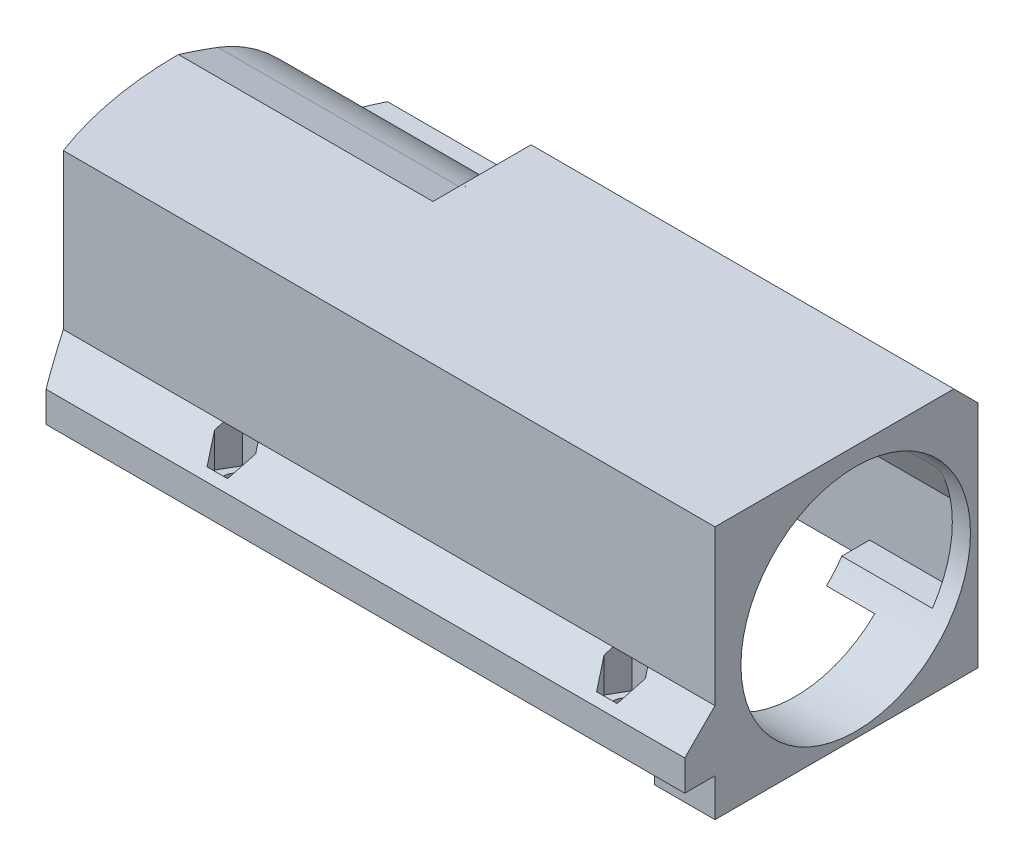
from build123d import *
from build123d.topology import SkipClean

# Parameters (mm, degrees)
BOSS_EXTRUDE1_DEPTH            = 46.6
CUT_EXTRUDE1_REACH             = 137.409
SKETCH2_R                      = 19
SKETCH3_W                      = 3
SKETCH3_H                      = 30.7
BOSS_EXTRUDE2_DEPTH            = 120
SKETCH4_W                      = 5
SKETCH4_H                      = 7.85
BOSS_EXTRUDE3_DEPTH            = 120
SKETCH6_W                      = 3
SKETCH6_H                      = 35.7
BOSS_EXTRUDE4_DEPTH            = 120
SKETCH8_W                      = 4.95
SKETCH8_H                      = 35.7
BOSS_EXTRUDE5_DEPTH            = 120
BOSS_EXTRUDE7_DEPTH            = 117
CHAMFER2_SIZE                  = 8
M3_CLEARANCE_HOLE1_D           = 3.4
M3_CLEARANCE_HOLE1_ON_FACE_2_D = 3.4
SKETCH12_W                     = 8
SKETCH12_H                     = 17.7
CUT_EXTRUDE4_DEPTH             = 140.841195647
CHAMFER4_SIZE                  = 4
CHAMFER5_SIZE                  = 2
CUT_EXTRUDE5_START             = 6.3
CUT_EXTRUDE5_DEPTH             = 35.7
CUT_EXTRUDE6_START             = -70
CUT_EXTRUDE6_DEPTH             = 61.400086431
CUT_EXTRUDE7_START             = -4.5
CUT_EXTRUDE7_DEPTH             = 6.7
M3_CLEARANCE_HOLE2_D           = 3.6
M3_CLEARANCE_HOLE2_DEPTH       = 12.65
CHAMFER6_SIZE                  = 2.2
CUT_EXTRUDE8_DEPTH             = 131.400086431


# Read off the part's stored shape, not the designer's step: Cut-Extrude5
with BuildPart() as part:
    # Sketch1 → Boss-Extrude1 (new body)
    with BuildSketch(Plane.XY):
        Polygon((0, 0), (0, 42), (-120, 42), (-120, 37), (-3, 37), (-3, 9.3), (-18, 9.3), (-18, 6.3), (-10, 6.3), (-10, 0), align=None)
    extrude(amount=BOSS_EXTRUDE1_DEPTH)

    # Sketch2 → Cut-Extrude1 (cut, up to next)
    with BuildSketch(Plane(origin=(0, 0, 0), x_dir=(0, 0, -1), z_dir=(1, 0, 0)), mode=Mode.PRIVATE) as cut_extrude1_sk1:
        with Locations((-23.3, 20)):
            Circle(SKETCH2_R)
    cut_extrude1_tool1 = extrude(cut_extrude1_sk1.sketch, amount=-CUT_EXTRUDE1_REACH, mode=Mode.PRIVATE) & part.part
    add(cut_extrude1_tool1.solids().sort_by_distance((0, 20, 23.3))[0], mode=Mode.SUBTRACT)

    # Sketch3 → Boss-Extrude2 (add)
    with BuildSketch(Plane.ZY.offset(3)):
        with Locations((45.1, 21.65)):
            Rectangle(SKETCH3_W, SKETCH3_H)
    extrude(amount=BOSS_EXTRUDE2_DEPTH)

    # Sketch4 → Boss-Extrude3 (add)
    with BuildSketch(Plane(origin=(0, 0, 0), x_dir=(0, 0, -1), z_dir=(1, 0, 0))):
        with Locations((-49.1, 10.225)):
            Rectangle(SKETCH4_W, SKETCH4_H)
    extrude(amount=-BOSS_EXTRUDE3_DEPTH)

    # Sketch6 → Boss-Extrude4 (add)
    with BuildSketch(Plane(origin=(0, 0, 0), x_dir=(0, 0, -1), z_dir=(1, 0, 0))):
        with Locations((-1.5, 24.15)):
            Rectangle(SKETCH6_W, SKETCH6_H)
    extrude(amount=-BOSS_EXTRUDE4_DEPTH)

    # Sketch8 → Boss-Extrude5 (add)
    with BuildSketch(Plane(origin=(0, 0, 0), x_dir=(0, 0, -1), z_dir=(1, 0, 0))):
        with Locations((2.475, 24.15)):
            Rectangle(SKETCH8_W, SKETCH8_H)
    extrude(amount=-BOSS_EXTRUDE5_DEPTH)

    # Sketch14 → Boss-Extrude7 (add)
    with SkipClean():  # the faces are left unmerged after this step: merging them gives an invalid solid
        with BuildSketch(Plane.ZY.offset(3)):
            with BuildLine():
                Line((6.365553185, 28.615364824), (3, 22))
                Line((3, 22), (3, 37))
                Line((3, 37), (14.814718626, 37))
                ThreePointArc((14.814718626, 37), (9.91657099, 33.486431253), (6.365553185, 28.615364824))
            make_face()
            with BuildLine():
                Line((40.234446815, 28.615364824), (43.6, 22))
                Line((43.6, 22), (43.6, 37))
                Line((43.6, 37), (31.785281374, 37))
                ThreePointArc((31.785281374, 37), (36.68342901, 33.486431253), (40.234446815, 28.615364824))
            make_face()
        extrude(amount=BOSS_EXTRUDE7_DEPTH)

    # Chamfer2
    chamfer2_edges = [part.edges().sort_by_distance(p)[0] for p in [
        (0, 24.15, -4.95),
    ]]
    chamfer(chamfer2_edges, length=CHAMFER2_SIZE)

    # M3 Clearance Hole1 (through all)
    with Locations(Plane(origin=(-14, 0, -0.95), x_dir=(0, 0, -1), z_dir=(0, -1, 0))):
        with Locations((0, 0)):
            Hole(M3_CLEARANCE_HOLE1_D / 2)

    # M3 Clearance Hole1 on face 2 (through all)
    with Locations(Plane(origin=(-78.5, -3, -0.95), x_dir=(0, 0, -1), z_dir=(0, -1, 0))):
        with Locations((0, 0)):
            Hole(M3_CLEARANCE_HOLE1_ON_FACE_2_D / 2)

    # Sketch12 → Cut-Extrude4 (cut, through all)
    with SkipClean():  # the faces are left unmerged after this step: merging them gives an invalid solid
        with BuildSketch(Plane(origin=(0, 0, 0), x_dir=(0, 0, -1), z_dir=(1, 0, 0))):
            with Locations((0.95, 33.15)):
                Rectangle(SKETCH12_W, SKETCH12_H)
        extrude(amount=-CUT_EXTRUDE4_DEPTH, mode=Mode.SUBTRACT)

    # Chamfer4
    chamfer4_edges = [part.edges().sort_by_distance(p)[0] for p in [
        (-60, 42, 3.05),
    ]]
    chamfer(chamfer4_edges, length=CHAMFER4_SIZE)

    # Chamfer5
    chamfer5_edges = [part.edges().sort_by_distance(p)[0] for p in [
        (-60, 24.3, 3.05),
    ]]
    chamfer(chamfer5_edges, length=CHAMFER5_SIZE)

    # Cut-Extrude5 outline → Cut-Extrude5 (cut)
    with SkipClean():  # the faces are left unmerged after this step: merging them gives an invalid solid
        with BuildSketch(Plane(origin=(0, 0, 0), x_dir=(1, 0, 0), z_dir=(0, 1, 0)).offset(CUT_EXTRUDE5_START)):
            with BuildLine():
                Line((-120, -51.6), (-105.764031959, -51.6))
                ThreePointArc((-105.764031959, -51.6), (-112.149994188, -23.327677022), (-105.787782122, 4.95))
                Line((-105.787782122, 4.95), (-120, 4.95))
                Line((-120, 4.95), (-120, -43.6))
                Line((-120, -43.6), (-123, -43.6))
                Line((-123, -43.6), (-123, -46.6))
                Line((-123, -46.6), (-120, -46.6))
                Line((-120, -46.6), (-120, -51.6))
            make_face()
        extrude(amount=CUT_EXTRUDE5_DEPTH, mode=Mode.SUBTRACT)

    # Sketch16 → Cut-Extrude6 (cut, through all)
    with SkipClean():  # the faces are left unmerged after this step: merging them gives an invalid solid
        with BuildSketch(Plane(origin=(0, 0, 0), x_dir=(0, 0, -1), z_dir=(1, 0, 0)).offset(CUT_EXTRUDE6_START)):
            with BuildLine():
                Line((-3.05, 26.3), (-3.05, 42))
                Line((-3.05, 42), (-23.3, 42))
                Line((-23.3, 42), (-17.040626863, 40.045454545))
                ThreePointArc((-17.040626863, 40.045454545), (-9.51709951, 35.84397848), (-4.314345847, 28.97468308))
                Line((-4.314345847, 28.97468308), (-3.05, 26.3))
            make_face()
        extrude(amount=-CUT_EXTRUDE6_DEPTH, mode=Mode.SUBTRACT)

    # Sketch18 → Cut-Extrude7 (cut)
    with SkipClean():  # the faces are left unmerged after this step: merging them gives an invalid solid
        with BuildSketch(Plane(origin=(0, 14.15, 0), x_dir=(1, 0, 0), z_dir=(0, 1, 0)).offset(CUT_EXTRUDE7_START)):
            Polygon((-10.593633412, -47.55), (-12.296816706, -44.6), (-15.703183294, -44.6), (-17.406366588, -47.55), (-15.703183294, -50.5), (-12.296816706, -50.5), align=None)
            Polygon((-81.906366588, -47.55), (-80.203183294, -50.5), (-76.796816706, -50.5), (-75.093633412, -47.55), (-76.796816706, -44.6), (-80.203183294, -44.6), align=None)
        extrude(amount=CUT_EXTRUDE7_DEPTH, mode=Mode.SUBTRACT)

    # M3 Clearance Hole2
    with Locations(Plane(origin=(-78.5, -3, 47.55), x_dir=(0, 0, -1), z_dir=(0, -1, 0))):
        with Locations((0, 0), (0, 64.5)):
            Hole(M3_CLEARANCE_HOLE2_D / 2, depth=M3_CLEARANCE_HOLE2_DEPTH)

    # Chamfer6
    chamfer6_edges = [part.edges().sort_by_distance(p)[0] for p in [
        (-94.625687487, 14.15, 46.6),
        (-46.25, 14.15, 46.6),
        (-5.571058084, 14.15, 46.6),
    ]]
    chamfer(chamfer6_edges, length=CHAMFER6_SIZE)

    # Sketch23 → Cut-Extrude8 (cut, through all)
    with SkipClean():  # the faces are left unmerged after this step: merging them gives an invalid solid
        with BuildSketch(Plane(origin=(0, 0, 0), x_dir=(0, 0, -1), z_dir=(1, 0, 0))):
            Polygon((-48.8, 14.15), (-51.6, 11.35), (-51.6, 14.15), align=None)
        extrude(amount=-CUT_EXTRUDE8_DEPTH, mode=Mode.SUBTRACT)


solid = part.part
